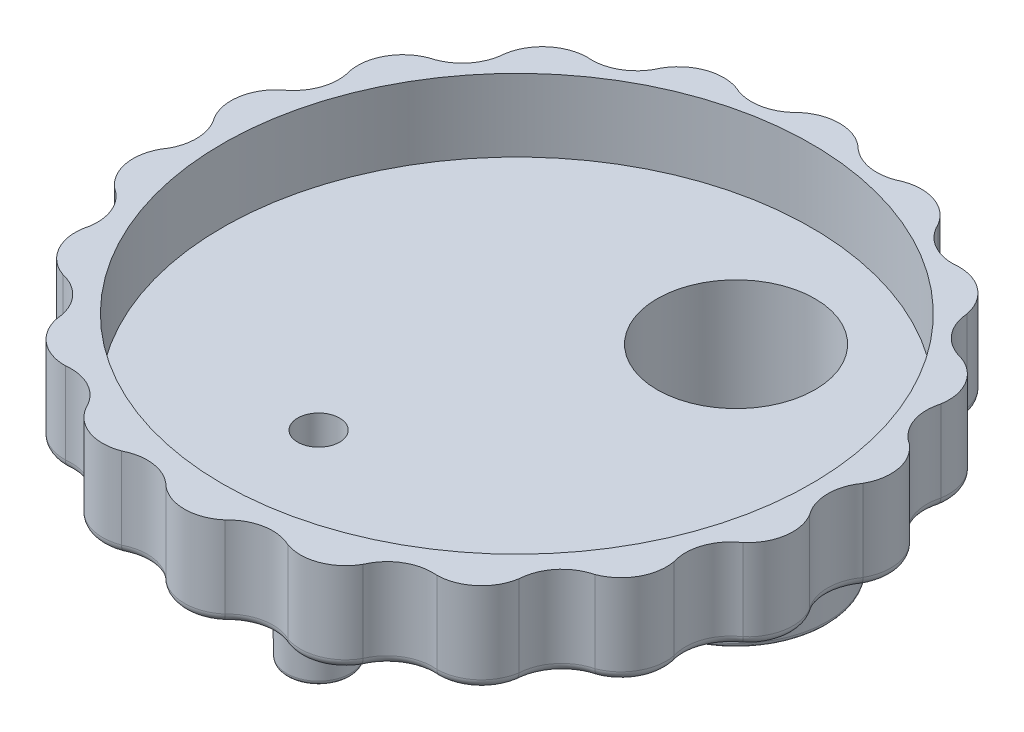
from build123d import *

# Parameters (mm, degrees)
BOSS_EXTRUDE1_DEPTH = 10
SKETCH3_R           = 32.5
CUT_EXTRUDE2_DEPTH  = 8
FILLET1_ANGLE       = 79.961079
FILLET1_2_ANGLE     = 73.017621
FILLET1_3_ANGLE     = 73.017621
FILLET1_4_ANGLE     = 79.961079
FILLET1_5_ANGLE     = 79.961079
FILLET1_6_ANGLE     = 73.017621
FILLET1_7_ANGLE     = 73.017621
FILLET1_8_ANGLE     = 79.961079
FILLET1_9_ANGLE     = 79.961079
FILLET1_10_ANGLE    = 73.017621
FILLET1_11_ANGLE    = 73.017621
FILLET1_12_ANGLE    = 79.961079
FILLET1_13_ANGLE    = 79.961079
FILLET1_14_ANGLE    = 73.017621
FILLET1_15_ANGLE    = 73.017621
FILLET1_16_ANGLE    = 79.961079
FILLET1_17_ANGLE    = 79.961079
FILLET1_18_ANGLE    = 73.017621
FILLET1_19_ANGLE    = 73.017621
FILLET1_20_ANGLE    = 79.961079
FILLET1_21_ANGLE    = 79.961079
FILLET1_22_ANGLE    = 73.017621
FILLET1_23_ANGLE    = 73.017621
FILLET1_24_ANGLE    = 79.961079
FILLET1_25_ANGLE    = 79.961079
FILLET1_26_ANGLE    = 73.017621
FILLET1_27_ANGLE    = 73.017621
FILLET1_28_ANGLE    = 79.961079
FILLET1_29_ANGLE    = 79.961079
FILLET1_30_ANGLE    = 73.017621
FILLET1_31_ANGLE    = 73.017621
FILLET1_32_ANGLE    = 79.961079
FILLET1_33_ANGLE    = 79.961079
FILLET1_34_ANGLE    = 73.017621
FILLET1_35_ANGLE    = 73.017621
FILLET1_36_ANGLE    = 79.961079
SKETCH4_R           = 10.04531313
SKETCH4_R_2         = 3.507858524
BOSS_EXTRUDE2_DEPTH = 20
SKETCH5_R           = 8.707873344
SKETCH5_R_2         = 2.313118836
CUT_EXTRUDE3_DEPTH  = 32
DRAFT1_ANGLE        = 1
FILLET2_R           = 0.5


with BuildPart() as part:
    # Sketch1 → Boss-Extrude1 (new body)
    with BuildSketch(Plane(origin=(0, 0, 0), x_dir=(1, 0, 0), z_dir=(0, 1, 0))):
        with BuildLine():
            ThreePointArc((-3.668918352, 34.80716935), (-0.471866655, 36.017840314), (2.755804136, 34.891339091))
            ThreePointArc((2.755804136, 34.891339091), (5.530554666, 33.437898244), (8.625522476, 33.920500616))
            ThreePointArc((8.625522476, 33.920500616), (12.043842221, 33.964703107), (14.691574536, 31.802209794))
            ThreePointArc((14.691574536, 31.802209794), (16.801881086, 29.487401582), (19.875259231, 28.882358135))
            ThreePointArc((19.875259231, 28.882358135), (23.102547214, 27.754760681), (24.850985459, 24.817103887))
            ThreePointArc((24.850985459, 24.817103887), (26.042313915, 21.920128343), (28.723407633, 20.300416247))
            ThreePointArc((28.723407633, 20.300416247), (31.370405292, 18.137023742), (32.008662011, 14.77852823))
            ThreePointArc((32.008662011, 14.77852823), (32.13732058, 11.648803359), (34.102750399, 9.209783797))
            ThreePointArc((34.102750399, 9.209783797), (35.850190752, 6.271533306), (35.301282765, 2.897283202))
            ThreePointArc((35.301282765, 2.897283202), (34.351753323, -0.087699986), (35.3644594, -3.051845259))
            ThreePointArc((35.3644594, -3.051845259), (36.001575351, -6.410557364), (34.331709062, -9.393577699))
            ThreePointArc((34.331709062, -9.393577699), (32.418518875, -11.873786178), (32.356353912, -15.005537495))
            ThreePointArc((32.356353912, -15.005537495), (31.806299874, -18.379600965), (29.216885802, -20.611595253))
            ThreePointArc((29.216885802, -20.611595253), (26.570793841, -22.287879278), (25.441255849, -25.209501211))
            ThreePointArc((25.441255849, -25.209501211), (23.770376458, -28.191954194), (20.573736156, -29.403710985))
            ThreePointArc((20.573736156, -29.403710985), (17.513900164, -30.073885961), (15.453228096, -32.432987787))
            ThreePointArc((15.453228096, -32.432987787), (12.863056064, -34.664102438), (9.44475153, -34.709465978))
            ThreePointArc((9.44475153, -34.709465978), (6.340232886, -34.292698913), (3.596974206, -35.804738135))
            ThreePointArc((3.596974206, -35.804738135), (0.399922508, -37.015409099), (-2.827748283, -35.888907876))
            ThreePointArc((-2.827748283, -35.888907876), (-5.602498812, -34.435467029), (-8.697466622, -34.918069401))
            ThreePointArc((-8.697466622, -34.918069401), (-12.115786367, -34.962271892), (-14.763518682, -32.799778579))
            ThreePointArc((-14.763518682, -32.799778579), (-16.873825233, -30.484970367), (-19.947203378, -29.87992692))
            ThreePointArc((-19.947203378, -29.87992692), (-23.17449136, -28.752329467), (-24.922929605, -25.814672672))
            ThreePointArc((-24.922929605, -25.814672672), (-26.114258062, -22.917697128), (-28.795351779, -21.297985032))
            ThreePointArc((-28.795351779, -21.297985032), (-31.442349439, -19.134592527), (-32.080606158, -15.776097015))
            ThreePointArc((-32.080606158, -15.776097015), (-32.209264726, -12.646372144), (-34.174694545, -10.207352582))
            ThreePointArc((-34.174694545, -10.207352582), (-35.922134898, -7.269102091), (-35.373226911, -3.894851987))
            ThreePointArc((-35.373226911, -3.894851987), (-34.42369747, -0.909868799), (-35.436403547, 2.054276474))
            ThreePointArc((-35.436403547, 2.054276474), (-36.073519498, 5.412988579), (-34.403653209, 8.396008914))
            ThreePointArc((-34.403653209, 8.396008914), (-32.490463021, 10.876217393), (-32.428298058, 14.00796871))
            ThreePointArc((-32.428298058, 14.00796871), (-31.87824402, 17.38203218), (-29.288829948, 19.614026468))
            ThreePointArc((-29.288829948, 19.614026468), (-26.642737988, 21.290310493), (-25.513199996, 24.211932426))
            ThreePointArc((-25.513199996, 24.211932426), (-23.842320604, 27.194385409), (-20.645680302, 28.4061422))
            ThreePointArc((-20.645680302, 28.4061422), (-17.58584431, 29.076317176), (-15.525172242, 31.435419002))
            ThreePointArc((-15.525172242, 31.435419002), (-12.935000211, 33.666533653), (-9.516695676, 33.711897193))
            ThreePointArc((-9.516695676, 33.711897193), (-6.412177033, 33.295130128), (-3.668918352, 34.80716935))
        make_face()
    extrude(amount=BOSS_EXTRUDE1_DEPTH)

    # Sketch3 → Cut-Extrude2 (cut)
    with BuildSketch(Plane(origin=(0, 10, 0), x_dir=(1, 0, 0), z_dir=(0, 1, 0))):
        with Locations(Location((0, 0, 0), (0, 0, 270))):
            Circle(SKETCH3_R)
    extrude(amount=-CUT_EXTRUDE2_DEPTH, mode=Mode.SUBTRACT)

    # Fillet1: read off the stored shape, not the designer's step
    # Fillet1 outline → Fillet1 (revolve, cut)
    with BuildSketch(Plane(origin=(11.091553202, 0, 29.988444451), x_dir=(-0.3293603377334513, 0, 0.9442043041249637), z_dir=(-0.9442043041249637, 0, -0.3293603377334513))):
        with BuildLine():
            ThreePointArc((5, 1), (4.707106781, 0.292893219), (4, 0))
            Line((4, 0), (5, 0))
            Line((5, 0), (5, 1))
        make_face()
    revolve(axis=Axis((11.091553202, 0, 29.988444451), (0, 1, 0)), revolution_arc=FILLET1_ANGLE, mode=Mode.SUBTRACT)

    # Fillet1 2 outline → Fillet1 2 (revolve, cut)
    with BuildSketch(Plane(origin=(7.260712592, 0, 39.207240307), x_dir=(0.43680778758736893, 0, -0.8995548658659059), z_dir=(0.8995548658659059, 0, 0.43680778758736893))):
        with BuildLine():
            ThreePointArc((6, 0), (5.292893219, 0.292893219), (5, 1))
            Line((5, 1), (5, 0))
            Line((5, 0), (6, 0))
        make_face()
    revolve(axis=Axis((7.260712592, 0, 39.207240307), (0, 1, 0)), revolution_arc=FILLET1_2_ANGLE, mode=Mode.SUBTRACT)

    # Fillet1 3 outline → Fillet1 3 (revolve, cut)
    with BuildSketch(Plane(origin=(20.059740303, 0, 34.377221643), x_dir=(0.10279917054490102, 0, -0.9947021315626504), z_dir=(0.9947021315626504, 0, 0.10279917054490102))):
        with BuildLine():
            ThreePointArc((6, 0), (5.292893219, 0.292893219), (5, 1))
            Line((5, 1), (5, 0))
            Line((5, 0), (6, 0))
        make_face()
    revolve(axis=Axis((20.059740303, 0, 34.377221643), (0, 1, 0)), revolution_arc=FILLET1_3_ANGLE, mode=Mode.SUBTRACT)

    # Fillet1 4 outline → Fillet1 4 (revolve, cut)
    with BuildSketch(Plane(origin=(0.334423555, 0, 32.015838129), x_dir=(-0.632434370373212, 0, 0.7746139471831365), z_dir=(-0.7746139471831365, 0, -0.632434370373212))):
        with BuildLine():
            ThreePointArc((5, 1), (4.707106781, 0.292893219), (4, 0))
            Line((4, 0), (5, 0))
            Line((5, 0), (5, 1))
        make_face()
    revolve(axis=Axis((0.334423555, 0, 32.015838129), (0, 1, 0)), revolution_arc=FILLET1_4_ANGLE, mode=Mode.SUBTRACT)

    # Fillet1 5 outline → Fillet1 5 (revolve, cut)
    with BuildSketch(Plane(origin=(20.506539075, 0, 24.40416255), x_dir=(0.013439412477851076, 0, 0.9999096870179077), z_dir=(-0.9999096870179077, 0, 0.013439412477851076))):
        with BuildLine():
            ThreePointArc((5, 1), (4.707106781, 0.292893219), (4, 0))
            Line((4, 0), (5, 0))
            Line((5, 0), (5, 1))
        make_face()
    revolve(axis=Axis((20.506539075, 0, 24.40416255), (0, 1, 0)), revolution_arc=FILLET1_5_ANGLE, mode=Mode.SUBTRACT)

    # Fillet1 6 outline → Fillet1 6 (revolve, cut)
    with BuildSketch(Plane(origin=(-6.418402977, 0, 39.368447913), x_dir=(0.7181309388504219, 0, -0.6959080073298566), z_dir=(0.6959080073298566, 0, 0.7181309388504219))):
        with BuildLine():
            ThreePointArc((6, 0), (5.292893219, 0.292893219), (5, 1))
            Line((5, 1), (5, 0))
            Line((5, 0), (6, 0))
        make_face()
    revolve(axis=Axis((-6.418402977, 0, 39.368447913), (0, 1, 0)), revolution_arc=FILLET1_6_ANGLE, mode=Mode.SUBTRACT)

    # Fillet1 7 outline → Fillet1 7 (revolve, cut)
    with BuildSketch(Plane(origin=(30.43492852, 0, 25.460963453), x_dir=(-0.24360854361943612, 0, -0.9698736399529669), z_dir=(0.9698736399529669, 0, -0.24360854361943612))):
        with BuildLine():
            ThreePointArc((6, 0), (5.292893219, 0.292893219), (5, 1))
            Line((5, 1), (5, 0))
            Line((5, 0), (6, 0))
        make_face()
    revolve(axis=Axis((30.43492852, 0, 25.460963453), (0, 1, 0)), revolution_arc=FILLET1_7_ANGLE, mode=Mode.SUBTRACT)

    # Fillet1 8 outline → Fillet1 8 (revolve, cut)
    with BuildSketch(Plane(origin=(-10.46738127, 0, 30.241809983), x_dir=(-0.8592274842087299, 0, 0.5115937161267102), z_dir=(-0.5115937161267102, 0, -0.8592274842087299))):
        with BuildLine():
            ThreePointArc((5, 1), (4.707106781, 0.292893219), (4, 0))
            Line((4, 0), (5, 0))
            Line((5, 0), (5, 1))
        make_face()
    revolve(axis=Axis((-10.46738127, 0, 30.241809983), (0, 1, 0)), revolution_arc=FILLET1_8_ANGLE, mode=Mode.SUBTRACT)

    # Fillet1 9 outline → Fillet1 9 (revolve, cut)
    with BuildSketch(Plane(origin=(27.443794929, 0, 15.936539237), x_dir=(0.3546181711997289, 0, 0.9350112045611859), z_dir=(-0.9350112045611859, 0, 0.3546181711997289))):
        with BuildLine():
            ThreePointArc((5, 1), (4.707106781, 0.292893219), (4, 0))
            Line((4, 0), (5, 0))
            Line((5, 0), (5, 1))
        make_face()
    revolve(axis=Axis((27.443794929, 0, 15.936539237), (0, 1, 0)), revolution_arc=FILLET1_9_ANGLE, mode=Mode.SUBTRACT)

    # Fillet1 10 outline → Fillet1 10 (revolve, cut)
    with BuildSketch(Plane(origin=(-19.327703184, 0, 34.841400442), x_dir=(0.9128369004042345, 0, -0.4083243726014769), z_dir=(0.4083243726014769, 0, 0.9128369004042345))):
        with BuildLine():
            ThreePointArc((6, 0), (5.292893219, 0.292893219), (5, 1))
            Line((5, 1), (5, 0))
            Line((5, 0), (6, 0))
        make_face()
    revolve(axis=Axis((-19.327703184, 0, 34.841400442), (0, 1, 0)), revolution_arc=FILLET1_10_ANGLE, mode=Mode.SUBTRACT)

    # Fillet1 11 outline → Fillet1 11 (revolve, cut)
    with BuildSketch(Plane(origin=(37.134876423, 0, 13.533898066), x_dir=(-0.5606334721440812, 0, -0.8280640735544996), z_dir=(0.8280640735544996, 0, -0.5606334721440812))):
        with BuildLine():
            ThreePointArc((6, 0), (5.292893219, 0.292893219), (5, 1))
            Line((5, 1), (5, 0))
            Line((5, 0), (6, 0))
        make_face()
    revolve(axis=Axis((37.134876423, 0, 13.533898066), (0, 1, 0)), revolution_arc=FILLET1_11_ANGLE, mode=Mode.SUBTRACT)

    # Fillet1 12 outline → Fillet1 12 (revolve, cut)
    with BuildSketch(Plane(origin=(-20.011004196, 0, 24.880333991), x_dir=(-0.982385082601552, 0, 0.18686773258629155), z_dir=(-0.18686773258629155, 0, -0.982385082601552))):
        with BuildLine():
            ThreePointArc((5, 1), (4.707106781, 0.292893219), (4, 0))
            Line((4, 0), (5, 0))
            Line((5, 0), (5, 1))
        make_face()
    revolve(axis=Axis((-20.011004196, 0, 24.880333991), (0, 1, 0)), revolution_arc=FILLET1_12_ANGLE, mode=Mode.SUBTRACT)

    # Fillet1 13 outline → Fillet1 13 (revolve, cut)
    with BuildSketch(Plane(origin=(31.066585324, 0, 5.606894853), x_dir=(0.6530247448681057, 0, 0.757336571538669), z_dir=(-0.757336571538669, 0, 0.6530247448681057))):
        with BuildLine():
            ThreePointArc((5, 1), (4.707106781, 0.292893219), (4, 0))
            Line((4, 0), (5, 0))
            Line((5, 0), (5, 1))
        make_face()
    revolve(axis=Axis((31.066585324, 0, 5.606894853), (0, 1, 0)), revolution_arc=FILLET1_13_ANGLE, mode=Mode.SUBTRACT)

    # Fillet1 14 outline → Fillet1 14 (revolve, cut)
    with BuildSketch(Plane(origin=(-29.910135904, 0, 26.172126633), x_dir=(0.9974412597314618, 0, -0.07149079231141979), z_dir=(0.07149079231141979, 0, 0.9974412597314618))):
        with BuildLine():
            ThreePointArc((6, 0), (5.292893219, 0.292893219), (5, 1))
            Line((5, 1), (5, 0))
            Line((5, 0), (6, 0))
        make_face()
    revolve(axis=Axis((-29.910135904, 0, 26.172126633), (0, 1, 0)), revolution_arc=FILLET1_14_ANGLE, mode=Mode.SUBTRACT)

    # Fillet1 15 outline → Fillet1 15 (revolve, cut)
    with BuildSketch(Plane(origin=(39.351471414, 0, 0.034605593), x_dir=(-0.8100377298593346, 0, -0.5863777589611798), z_dir=(0.5863777589611798, 0, -0.8100377298593346))):
        with BuildLine():
            ThreePointArc((6, 0), (5.292893219, 0.292893219), (5, 1))
            Line((5, 1), (5, 0))
            Line((5, 0), (6, 0))
        make_face()
    revolve(axis=Axis((39.351471414, 0, 0.034605593), (0, 1, 0)), revolution_arc=FILLET1_15_ANGLE, mode=Mode.SUBTRACT)

    # Fillet1 16 outline → Fillet1 16 (revolve, cut)
    with BuildSketch(Plane(origin=(-27.145343447, 0, 16.578083284), x_dir=(-0.9870525415729385, 0, -0.16039725737805618), z_dir=(0.16039725737805618, 0, -0.9870525415729385))):
        with BuildLine():
            ThreePointArc((5, 1), (4.707106781, 0.292893219), (4, 0))
            Line((4, 0), (5, 0))
            Line((5, 0), (5, 1))
        make_face()
    revolve(axis=Axis((-27.145343447, 0, 16.578083284), (0, 1, 0)), revolution_arc=FILLET1_16_ANGLE, mode=Mode.SUBTRACT)

    # Fillet1 17 outline → Fillet1 17 (revolve, cut)
    with BuildSketch(Plane(origin=(30.937948272, 0, -5.338863041), x_dir=(0.8726668966865783, 0, 0.4883159708912017), z_dir=(-0.4883159708912017, 0, 0.8726668966865783))):
        with BuildLine():
            ThreePointArc((5, 1), (4.707106781, 0.292893219), (4, 0))
            Line((4, 0), (5, 0))
            Line((5, 0), (5, 1))
        make_face()
    revolve(axis=Axis((30.937948272, 0, -5.338863041), (0, 1, 0)), revolution_arc=FILLET1_17_ANGLE, mode=Mode.SUBTRACT)

    # Fillet1 18 outline → Fillet1 18 (revolve, cut)
    with BuildSketch(Plane(origin=(-36.88930357, 0, 14.406268852), x_dir=(0.9617394824698762, 0, 0.2739656326230988), z_dir=(-0.2739656326230988, 0, 0.9617394824698762))):
        with BuildLine():
            ThreePointArc((6, 0), (5.292893219, 0.292893219), (5, 1))
            Line((5, 1), (5, 0))
            Line((5, 0), (6, 0))
        make_face()
    revolve(axis=Axis((-36.88930357, 0, 14.406268852), (0, 1, 0)), revolution_arc=FILLET1_18_ANGLE, mode=Mode.SUBTRACT)

    # Fillet1 19 outline → Fillet1 19 (revolve, cut)
    with BuildSketch(Plane(origin=(36.817359424, 0, -13.408700067), x_dir=(-0.9617394824698761, 0, -0.2739656326230991), z_dir=(0.2739656326230991, 0, -0.9617394824698761))):
        with BuildLine():
            ThreePointArc((6, 0), (5.292893219, 0.292893219), (5, 1))
            Line((5, 1), (5, 0))
            Line((5, 0), (6, 0))
        make_face()
    revolve(axis=Axis((36.817359424, 0, -13.408700067), (0, 1, 0)), revolution_arc=FILLET1_19_ANGLE, mode=Mode.SUBTRACT)

    # Fillet1 20 outline → Fillet1 20 (revolve, cut)
    with BuildSketch(Plane(origin=(-31.009892419, 0, 6.336431826), x_dir=(-0.8726668966865795, 0, -0.4883159708911996), z_dir=(0.4883159708911996, 0, -0.8726668966865795))):
        with BuildLine():
            ThreePointArc((5, 1), (4.707106781, 0.292893219), (4, 0))
            Line((4, 0), (5, 0))
            Line((5, 0), (5, 1))
        make_face()
    revolve(axis=Axis((-31.009892419, 0, 6.336431826), (0, 1, 0)), revolution_arc=FILLET1_20_ANGLE, mode=Mode.SUBTRACT)

    # Fillet1 21 outline → Fillet1 21 (revolve, cut)
    with BuildSketch(Plane(origin=(27.073399301, 0, -15.580514499), x_dir=(0.9870525415729393, 0, 0.16039725737805127), z_dir=(-0.16039725737805127, 0, 0.9870525415729393))):
        with BuildLine():
            ThreePointArc((5, 1), (4.707106781, 0.292893219), (4, 0))
            Line((4, 0), (5, 0))
            Line((5, 0), (5, 1))
        make_face()
    revolve(axis=Axis((27.073399301, 0, -15.580514499), (0, 1, 0)), revolution_arc=FILLET1_21_ANGLE, mode=Mode.SUBTRACT)

    # Fillet1 22 outline → Fillet1 22 (revolve, cut)
    with BuildSketch(Plane(origin=(-39.42341556, 0, 0.962963192), x_dir=(0.8100377298593349, 0, 0.5863777589611796), z_dir=(-0.5863777589611796, 0, 0.8100377298593349))):
        with BuildLine():
            ThreePointArc((6, 0), (5.292893219, 0.292893219), (5, 1))
            Line((5, 1), (5, 0))
            Line((5, 0), (6, 0))
        make_face()
    revolve(axis=Axis((-39.42341556, 0, 0.962963192), (0, 1, 0)), revolution_arc=FILLET1_22_ANGLE, mode=Mode.SUBTRACT)

    # Fillet1 23 outline → Fillet1 23 (revolve, cut)
    with BuildSketch(Plane(origin=(29.838191758, 0, -25.174557848), x_dir=(-0.9974412597314619, 0, 0.07149079231141847), z_dir=(-0.07149079231141847, 0, -0.9974412597314619))):
        with BuildLine():
            ThreePointArc((6, 0), (5.292893219, 0.292893219), (5, 1))
            Line((5, 1), (5, 0))
            Line((5, 0), (6, 0))
        make_face()
    revolve(axis=Axis((29.838191758, 0, -25.174557848), (0, 1, 0)), revolution_arc=FILLET1_23_ANGLE, mode=Mode.SUBTRACT)

    # Fillet1 24 outline → Fillet1 24 (revolve, cut)
    with BuildSketch(Plane(origin=(-31.138529471, 0, -4.609326068), x_dir=(-0.6530247448680984, 0, -0.7573365715386753), z_dir=(0.7573365715386753, 0, -0.6530247448680984))):
        with BuildLine():
            ThreePointArc((5, 1), (4.707106781, 0.292893219), (4, 0))
            Line((4, 0), (5, 0))
            Line((5, 0), (5, 1))
        make_face()
    revolve(axis=Axis((-31.138529471, 0, -4.609326068), (0, 1, 0)), revolution_arc=FILLET1_24_ANGLE, mode=Mode.SUBTRACT)

    # Fillet1 25 outline → Fillet1 25 (revolve, cut)
    with BuildSketch(Plane(origin=(19.939060049, 0, -23.882765206), x_dir=(0.9823850826015557, 0, -0.18686773258627257), z_dir=(0.18686773258627257, 0, 0.9823850826015557))):
        with BuildLine():
            ThreePointArc((5, 1), (4.707106781, 0.292893219), (4, 0))
            Line((4, 0), (5, 0))
            Line((5, 0), (5, 1))
        make_face()
    revolve(axis=Axis((19.939060049, 0, -23.882765206), (0, 1, 0)), revolution_arc=FILLET1_25_ANGLE, mode=Mode.SUBTRACT)

    # Fillet1 26 outline → Fillet1 26 (revolve, cut)
    with BuildSketch(Plane(origin=(-37.206820569, 0, -12.536329281), x_dir=(0.5606334721440943, 0, 0.8280640735544907), z_dir=(-0.8280640735544907, 0, 0.5606334721440943))):
        with BuildLine():
            ThreePointArc((6, 0), (5.292893219, 0.292893219), (5, 1))
            Line((5, 1), (5, 0))
            Line((5, 0), (6, 0))
        make_face()
    revolve(axis=Axis((-37.206820569, 0, -12.536329281), (0, 1, 0)), revolution_arc=FILLET1_26_ANGLE, mode=Mode.SUBTRACT)

    # Fillet1 27 outline → Fillet1 27 (revolve, cut)
    with BuildSketch(Plane(origin=(19.255759038, 0, -33.843831657), x_dir=(-0.912836900404234, 0, 0.4083243726014778), z_dir=(-0.4083243726014778, 0, -0.912836900404234))):
        with BuildLine():
            ThreePointArc((6, 0), (5.292893219, 0.292893219), (5, 1))
            Line((5, 1), (5, 0))
            Line((5, 0), (6, 0))
        make_face()
    revolve(axis=Axis((19.255759038, 0, -33.843831657), (0, 1, 0)), revolution_arc=FILLET1_27_ANGLE, mode=Mode.SUBTRACT)

    # Fillet1 28 outline → Fillet1 28 (revolve, cut)
    with BuildSketch(Plane(origin=(-27.515739075, 0, -14.938970452), x_dir=(-0.3546181711997236, 0, -0.9350112045611879), z_dir=(0.9350112045611879, 0, -0.3546181711997236))):
        with BuildLine():
            ThreePointArc((5, 1), (4.707106781, 0.292893219), (4, 0))
            Line((4, 0), (5, 0))
            Line((5, 0), (5, 1))
        make_face()
    revolve(axis=Axis((-27.515739075, 0, -14.938970452), (0, 1, 0)), revolution_arc=FILLET1_28_ANGLE, mode=Mode.SUBTRACT)

    # Fillet1 29 outline → Fillet1 29 (revolve, cut)
    with BuildSketch(Plane(origin=(10.395437124, 0, -29.244241198), x_dir=(0.8592274842087293, 0, -0.511593716126711), z_dir=(0.511593716126711, 0, 0.8592274842087293))):
        with BuildLine():
            ThreePointArc((5, 1), (4.707106781, 0.292893219), (4, 0))
            Line((4, 0), (5, 0))
            Line((5, 0), (5, 1))
        make_face()
    revolve(axis=Axis((10.395437124, 0, -29.244241198), (0, 1, 0)), revolution_arc=FILLET1_29_ANGLE, mode=Mode.SUBTRACT)

    # Fillet1 30 outline → Fillet1 30 (revolve, cut)
    with BuildSketch(Plane(origin=(-30.506872666, 0, -24.463394668), x_dir=(0.24360854361944206, 0, 0.9698736399529654), z_dir=(-0.9698736399529654, 0, 0.24360854361944206))):
        with BuildLine():
            ThreePointArc((6, 0), (5.292893219, 0.292893219), (5, 1))
            Line((5, 1), (5, 0))
            Line((5, 0), (6, 0))
        make_face()
    revolve(axis=Axis((-30.506872666, 0, -24.463394668), (0, 1, 0)), revolution_arc=FILLET1_30_ANGLE, mode=Mode.SUBTRACT)

    # Fillet1 31 outline → Fillet1 31 (revolve, cut)
    with BuildSketch(Plane(origin=(6.34645883, 0, -38.370879128), x_dir=(-0.7181309388504233, 0, 0.695908007329855), z_dir=(-0.695908007329855, 0, -0.7181309388504233))):
        with BuildLine():
            ThreePointArc((6, 0), (5.292893219, 0.292893219), (5, 1))
            Line((5, 1), (5, 0))
            Line((5, 0), (6, 0))
        make_face()
    revolve(axis=Axis((6.34645883, 0, -38.370879128), (0, 1, 0)), revolution_arc=FILLET1_31_ANGLE, mode=Mode.SUBTRACT)

    # Fillet1 32 outline → Fillet1 32 (revolve, cut)
    with BuildSketch(Plane(origin=(-20.578483222, 0, -23.406593765), x_dir=(-0.013439412477845624, 0, -0.9999096870179078), z_dir=(0.9999096870179078, 0, -0.013439412477845624))):
        with BuildLine():
            ThreePointArc((5, 1), (4.707106781, 0.292893219), (4, 0))
            Line((4, 0), (5, 0))
            Line((5, 0), (5, 1))
        make_face()
    revolve(axis=Axis((-20.578483222, 0, -23.406593765), (0, 1, 0)), revolution_arc=FILLET1_32_ANGLE, mode=Mode.SUBTRACT)

    # Fillet1 33 outline → Fillet1 33 (revolve, cut)
    with BuildSketch(Plane(origin=(-0.406367702, 0, -31.018269344), x_dir=(0.6324343703732225, 0, -0.7746139471831279), z_dir=(0.7746139471831279, 0, 0.6324343703732225))):
        with BuildLine():
            ThreePointArc((5, 1), (4.707106781, 0.292893219), (4, 0))
            Line((4, 0), (5, 0))
            Line((5, 0), (5, 1))
        make_face()
    revolve(axis=Axis((-0.406367702, 0, -31.018269344), (0, 1, 0)), revolution_arc=FILLET1_33_ANGLE, mode=Mode.SUBTRACT)

    # Fillet1 34 outline → Fillet1 34 (revolve, cut)
    with BuildSketch(Plane(origin=(-20.131684449, 0, -33.379652858), x_dir=(-0.10279917054490179, 0, 0.9947021315626504), z_dir=(-0.9947021315626504, 0, -0.10279917054490179))):
        with BuildLine():
            ThreePointArc((6, 0), (5.292893219, 0.292893219), (5, 1))
            Line((5, 1), (5, 0))
            Line((5, 0), (6, 0))
        make_face()
    revolve(axis=Axis((-20.131684449, 0, -33.379652858), (0, 1, 0)), revolution_arc=FILLET1_34_ANGLE, mode=Mode.SUBTRACT)

    # Fillet1 35 outline → Fillet1 35 (revolve, cut)
    with BuildSketch(Plane(origin=(-7.332656739, 0, -38.209671522), x_dir=(-0.4368077875873688, 0, 0.8995548658659059), z_dir=(-0.8995548658659059, 0, -0.4368077875873688))):
        with BuildLine():
            ThreePointArc((6, 0), (5.292893219, 0.292893219), (5, 1))
            Line((5, 1), (5, 0))
            Line((5, 0), (6, 0))
        make_face()
    revolve(axis=Axis((-7.332656739, 0, -38.209671522), (0, 1, 0)), revolution_arc=FILLET1_35_ANGLE, mode=Mode.SUBTRACT)

    # Fillet1 36 outline → Fillet1 36 (revolve, cut)
    with BuildSketch(Plane(origin=(-11.163497348, 0, -28.990875666), x_dir=(0.32936033773344914, 0, -0.9442043041249645), z_dir=(0.9442043041249645, 0, 0.32936033773344914))):
        with BuildLine():
            ThreePointArc((5, 1), (4.707106781, 0.292893219), (4, 0))
            Line((4, 0), (5, 0))
            Line((5, 0), (5, 1))
        make_face()
    revolve(axis=Axis((-11.163497348, 0, -28.990875666), (0, 1, 0)), revolution_arc=FILLET1_36_ANGLE, mode=Mode.SUBTRACT)

    # Sketch4 → Boss-Extrude2 (add)
    with BuildSketch(Plane.XZ):
        with Locations(Location((7.007071917, -17.188258409, 0), (0, 0, 90))):
            Circle(SKETCH4_R)
        with Locations(Location((-7.820389115, 14.055320192, 0), (0, 0, 90))):
            Circle(SKETCH4_R_2)
    extrude(amount=BOSS_EXTRUDE2_DEPTH)

    # Sketch5 → Cut-Extrude3 (cut)
    with BuildSketch(Plane.XZ.offset(20)):
        with Locations(Location((7.007071917, -17.188258409, 0), (0, 0, 270))):
            Circle(SKETCH5_R)
        with Locations(Location((-7.820389115, 14.055320192, 0), (0, 0, 270))):
            Circle(SKETCH5_R_2)
    extrude(amount=-CUT_EXTRUDE3_DEPTH, mode=Mode.SUBTRACT)

    # Draft1
    draft1_faces = [part.faces().sort_by_distance(p)[0] for p in [
        (-7.820389115, -10, 10.547461669),
    ]]
    draft(draft1_faces, Plane(origin=(-7.820389115, -20, 14.055320192), x_dir=(0, 0, -1), z_dir=(0, -1, 0)), DRAFT1_ANGLE)

    # Fillet2
    fillet2_edges = [part.edges().sort_by_distance(p)[0] for p in [
        (7.007071917, 0, -27.233571539),
        (7.007071917, -20, -27.233571539),
        (-7.820389115, 0, 10.19836037),
        (-7.820389115, -20, 10.547461669),
    ]]
    fillet(fillet2_edges, radius=FILLET2_R)


solid = part.part
